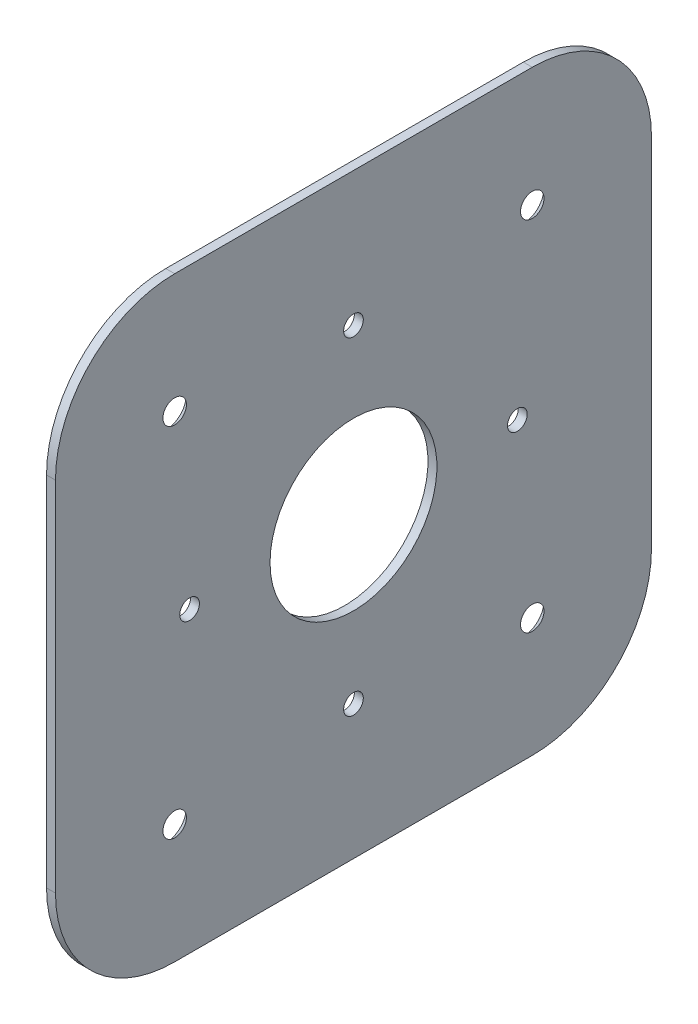
from build123d import *

# Parameters (mm, degrees)
SM_BASE_FLANGE_1_DEPTH      = 1.5
HOLE_WIZARD_M3_1_AT_2_COUNT = 2
HOLE_WIZARD_M3_1_AT_2_PITCH = 60
HOLE_WIZARD_M3_1_AT_3_COUNT = 2
HOLE_WIZARD_M3_1_AT_3_PITCH = 84.852813742
HOLE_WIZARD_M3_1_AT_4_COUNT = 2
HOLE_WIZARD_M3_1_AT_4_PITCH = 60
HOLE_WIZARD_1_D             = 28
HOLE_WIZARD_1_DEPTH         = 100
HOLE_WIZARD_M4_1_D          = 3.3
PATTERN_CIRCULAR_1_COUNT    = 4


# Sheet-metal steps are written as plain solids
with BuildPart() as part:
    # Sketch 1 → 基体-法兰1 (new body)
    with BuildSketch(Plane(origin=(0, 0, 0), x_dir=(0, 0, -1), z_dir=(1, 0, 0))):
        with BuildLine():
            Line((-30, -50), (30, -50))
            ThreePointArc((30, -50), (44.142135624, -44.142135624), (50, -30))
            Line((50, -30), (50, 30))
            ThreePointArc((50, 30), (44.142135624, 44.142135624), (30, 50))
            Line((30, 50), (-30, 50))
            ThreePointArc((-30, 50), (-44.142135624, 44.142135624), (-50, 30))
            Line((-50, 30), (-50, -30))
            ThreePointArc((-50, -30), (-44.142135624, -44.142135624), (-30, -50))
        make_face()
    extrude(amount=-SM_BASE_FLANGE_1_DEPTH)

    # 草图4 → M3 六角凹锥坑头螺钉的锥形沉头孔1 (revolve, cut)
    with BuildSketch(Plane(origin=(-1.5, 30, -30), x_dir=(0, 0, 1), z_dir=(0, 1, 0))):
        Polygon((0, 0), (0, 1.5), (1.7, 1.5), (1.7, 1.77), (3.47, 0), align=None)
    hole_wizard_m3_1 = revolve(axis=Axis((-7.85, 30, -30), (1, 0, 0)), mode=Mode.SUBTRACT)

    # M3 六角凹锥坑头螺钉的锥形沉头孔1 at 2: M3 六角凹锥坑头螺钉的锥形沉头孔1 ×2
    with Locations(*[(0, 0, i * HOLE_WIZARD_M3_1_AT_2_PITCH) for i in range(1, HOLE_WIZARD_M3_1_AT_2_COUNT)]):
        add(hole_wizard_m3_1, mode=Mode.SUBTRACT)

    # M3 六角凹锥坑头螺钉的锥形沉头孔1 at 3: M3 六角凹锥坑头螺钉的锥形沉头孔1 ×2
    with Locations(*[Vector(0, -0.7071067811865476, 0.7071067811865476) * (i * HOLE_WIZARD_M3_1_AT_3_PITCH) for i in range(1, HOLE_WIZARD_M3_1_AT_3_COUNT)]):
        add(hole_wizard_m3_1, mode=Mode.SUBTRACT)

    # M3 六角凹锥坑头螺钉的锥形沉头孔1 at 4: M3 六角凹锥坑头螺钉的锥形沉头孔1 ×2
    with Locations(*[(0, -i * HOLE_WIZARD_M3_1_AT_4_PITCH, 0) for i in range(1, HOLE_WIZARD_M3_1_AT_4_COUNT)]):
        add(hole_wizard_m3_1, mode=Mode.SUBTRACT)

    # 孔1
    with Locations(Plane.ZY.offset(1.5)):
        with Locations((0, 0)):
            Hole(HOLE_WIZARD_1_D / 2, depth=HOLE_WIZARD_1_DEPTH)

    # M4 螺纹孔1 (through all)
    with Locations(Plane.ZY.offset(1.5)):
        with Locations((0, 27.5)):
            hole_wizard_m4_1 = Hole(HOLE_WIZARD_M4_1_D / 2)

    # 阵列(圆周)1: M4 螺纹孔1 ×4 about axis
    pattern_circular_1_axis = Axis((0, 0, 0), (1, 0, 0))
    for i in range(1, PATTERN_CIRCULAR_1_COUNT):
        add(hole_wizard_m4_1.rotate(pattern_circular_1_axis, i * 360 / PATTERN_CIRCULAR_1_COUNT), mode=Mode.SUBTRACT)


solid = part.part
